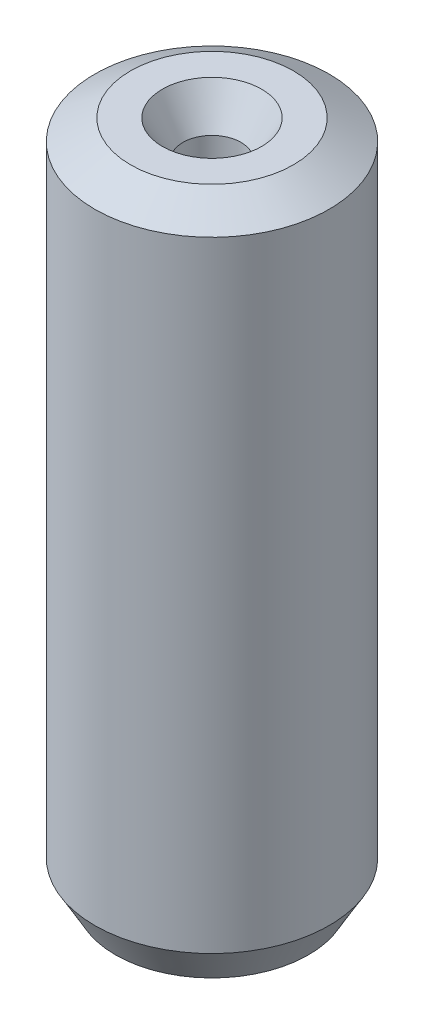
from build123d import *
from OCP.BRepFilletAPI import BRepFilletAPI_MakeChamfer

# Parameters (mm, degrees)
SKETCH1_R           = 5
BOSS_EXTRUDE1_DEPTH = 28.873624365
SKETCH2_R           = 1.238185381
CUT_EXTRUDE1_DEPTH  = 30.726859639
CHAMFER1_SIZE       = 0.880315781
CHAMFER1_SIZE2      = 1.52475166


with BuildPart() as part:
    # Sketch1 → Boss-Extrude1 (new body)
    with BuildSketch(Plane(origin=(0, 0, 0), x_dir=(1, 0, 0), z_dir=(0, 1, 0))):
        Circle(SKETCH1_R)
    extrude(amount=BOSS_EXTRUDE1_DEPTH)

    # Sketch2 → Cut-Extrude1 (cut, through all)
    with BuildSketch(Plane(origin=(0, 0, 0), x_dir=(1, 0, 0), z_dir=(0, 1, 0))):
        Circle(SKETCH2_R)
    extrude(amount=CUT_EXTRUDE1_DEPTH, mode=Mode.SUBTRACT)

    # Chamfer1: one chamfer whose edges measure the first distance from different faces: ONE call of the kernel's chamfer builder (chamfer() names one face for all edges)
    chamfer1_edges_1 = [part.edges().sort_by_distance(p)[0] for p in [
        (-1.238185381, 28.873624365, 0),
    ]]
    chamfer1_side_1 = [part.faces().sort_by_distance(p)[0] for p in [
        (-4.858578644, 28.873624365, 0),
    ]]
    chamfer1_edges_2 = [part.edges().sort_by_distance(p)[0] for p in [
        (-1.238185381, 0, 0),
    ]]
    chamfer1_side_2 = [part.faces().sort_by_distance(p)[0] for p in [
        (-1.238185381, 14.436812183, 0),
    ]]
    chamfer1_edges_3 = [part.edges().sort_by_distance(p)[0] for p in [
        (-5, 0, 0),
    ]]
    chamfer1_side_3 = [part.faces().sort_by_distance(p)[0] for p in [
        (-4.858578644, 0, 0),
    ]]
    chamfer1_edges_4 = [part.edges().sort_by_distance(p)[0] for p in [
        (-5, 28.873624365, 0),
    ]]
    chamfer1_side_4 = [part.faces().sort_by_distance(p)[0] for p in [
        (-5, 14.436812183, 0),
    ]]
    chamfer1 = BRepFilletAPI_MakeChamfer(part.part.solid().wrapped)
    for e in chamfer1_edges_1:
        chamfer1.Add(CHAMFER1_SIZE, CHAMFER1_SIZE2, e.wrapped, chamfer1_side_1[0].wrapped)  # the first distance lies on this face
    for e in chamfer1_edges_2:
        chamfer1.Add(CHAMFER1_SIZE, CHAMFER1_SIZE2, e.wrapped, chamfer1_side_2[0].wrapped)  # the first distance lies on this face
    for e in chamfer1_edges_3:
        chamfer1.Add(CHAMFER1_SIZE, CHAMFER1_SIZE2, e.wrapped, chamfer1_side_3[0].wrapped)  # the first distance lies on this face
    for e in chamfer1_edges_4:
        chamfer1.Add(CHAMFER1_SIZE, CHAMFER1_SIZE2, e.wrapped, chamfer1_side_4[0].wrapped)  # the first distance lies on this face
    add(Compound.cast(chamfer1.Shape()), mode=Mode.REPLACE)


solid = part.part
